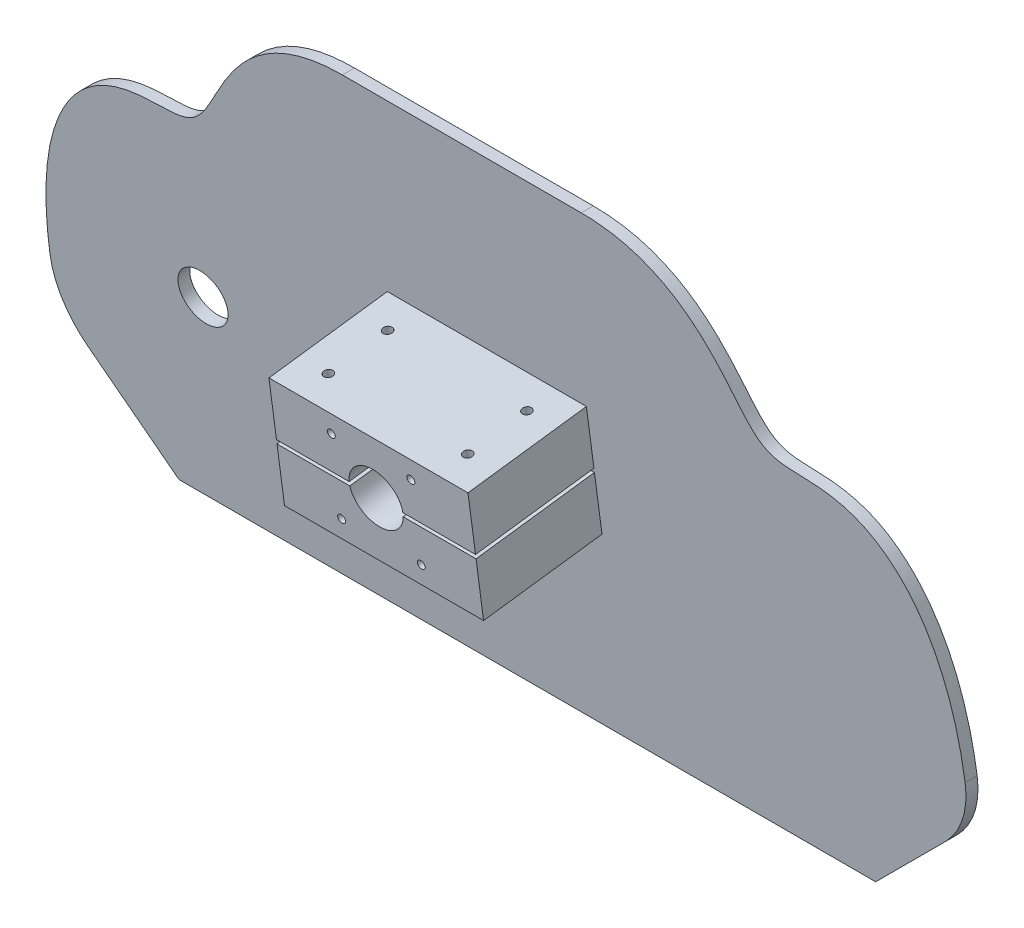
from build123d import *

# Parameters (mm, degrees)
EXTRUDE_START                      = -25
EXTRUDE_PLATE_SHAPE_DEPTH          = 50
CUT_EXTRUDE_ANGLE_DEPTH            = 341.53226913
CUT_EXTRUDE_ANGLE_DEPTH_BACK       = 341.53226913
EXTRUDE_SUPPORT_BLOCK_DEPTH        = 50
CUT_EXTRUDE_SHAFT_HOLE_DEPTH       = 349.426376391
CUT_EXTRUDE_SHAFT_HOLE_DEPTH_BACK  = 349.426376391
STEERING_WHEEL_SHAFT_HOLE_R        = 12.75
CUT_EXTRUDE_SWITCH_HOLE_DEPTH      = 349.426376391
CUT_EXTRUDE_SWITCH_HOLE_DEPTH_BACK = 349.426376391
IGNITION_SWITCH_HOLE_R             = 12.5
STEERING_WHEEL_RELIEF_HOLE_R       = 13.5
CUT_EXTRUDE_RELIEF_HOLE_DEPTH      = 60
CUT_EXTRUDE_SLOT_REACH             = 383.093
CUT_EXTRUDE_BOLT_HOLES_REACH       = 281.842
PRESSURE_BOLT_HOLES_R              = 2.25
ENCODER_PCB_MOUNT_HOLE_PATTERN_R   = 2
CUT_EXTRUDE_PCB_MOUNT_HOLES_DEPTH  = 60


# Read off the part's stored shape, not the designer's step: Extrude Plate Shape
with BuildPart() as part:
    # Extrude Plate Shape outline → Extrude Plate Shape (new body)
    with BuildSketch(Plane.XY.offset(EXTRUDE_START)):
        with BuildLine():
            Line((175, 0), (215.218833807, 40.218833807))
            ThreePointArc((215.218833807, 40.218833807), (226.057471223, 56.440000887), (229.863494748, 75.574172084))
            add(Edge.make_bspline(
                [(229.863494748, 75.574172084), (229.863497015, 220.574172084), (130.657195822, 208), (130.657198498, 108), (160, 250), (60, 250)],
                knots=[0, 0, 0, 0, 0, 0, 1, 1, 1, 1, 1, 1], degree=5))
            Line((60, 250), (-60, 250))
            add(Edge.make_bspline(
                [(-60, 250), (-160, 250), (-130.657198498, 108), (-130.657195822, 208), (-229.863497015, 220.574172084), (-229.863494748, 75.574172084)],
                knots=[0, 0, 0, 0, 0, 0, 1, 1, 1, 1, 1, 1], degree=5))
            ThreePointArc((-229.863494748, 75.574172084), (-226.057471223, 56.440000887), (-215.218833807, 40.218833807))
            Line((-215.218833807, 40.218833807), (-175, 0))
            Line((-175, 0), (175, 0))
        make_face()
    extrude(amount=EXTRUDE_PLATE_SHAPE_DEPTH)

    # 5-Degree Front Plate → Cut-Extrude Angle (cut, two sides: drawn at the far end of the back side and taken through both)
    with BuildSketch(Plane(origin=(0, 0, 0), x_dir=(0, 0, -1), z_dir=(1, 0, 0)).offset(-CUT_EXTRUDE_ANGLE_DEPTH_BACK)):
        Polygon((20.798974056, -10), (-14.747200293, 260), (35, 260), (35, -10), align=None)
        Polygon((-20.798974056, 260), (14.747200293, -10), (-35, -10), (-35, 260), align=None)
    extrude(amount=CUT_EXTRUDE_ANGLE_DEPTH + CUT_EXTRUDE_ANGLE_DEPTH_BACK, mode=Mode.SUBTRACT)

    # Support Block → Extrude Support Block (add, symmetric)
    with BuildSketch(Plane(origin=(0, 0, 0), x_dir=(0, 0, -1), z_dir=(1, 0, 0))):
        Polygon((-6.907883487, 154.486691682), (0.923688046, 95), (-58.563003637, 87.168428467), (-66.39457517, 146.655120149), align=None)
    extrude(amount=EXTRUDE_SUPPORT_BLOCK_DEPTH, both=True)

    # Steering Wheel Shaft Hole → Cut-Extrude Shaft Hole (cut, two sides: drawn at the far end of the back side and taken through both)
    with BuildSketch(Plane(origin=(0, 2.521214434, -19.150524903), x_dir=(-1, 0, 0), z_dir=(0, 0.13052619222005532, -0.99144486137381)).offset(-CUT_EXTRUDE_SHAFT_HOLE_DEPTH_BACK)):
        with Locations(Location((0, 124.614270251, 0), (0, 0, 90))):
            Circle(STEERING_WHEEL_SHAFT_HOLE_R)
    extrude(amount=CUT_EXTRUDE_SHAFT_HOLE_DEPTH + CUT_EXTRUDE_SHAFT_HOLE_DEPTH_BACK, mode=Mode.SUBTRACT)

    # Ignition Switch Hole → Cut-Extrude Switch Hole (cut, two sides: drawn at the far end of the back side and taken through both)
    with BuildSketch(Plane(origin=(0, 2.521214434, -19.150524903), x_dir=(-1, 0, 0), z_dir=(0, 0.13052619222005532, -0.99144486137381)).offset(-CUT_EXTRUDE_SWITCH_HOLE_DEPTH_BACK)):
        with Locations(Location((150, 97.457030106, 0), (0, 0, 90))):
            Circle(IGNITION_SWITCH_HOLE_R)
    extrude(amount=CUT_EXTRUDE_SWITCH_HOLE_DEPTH + CUT_EXTRUDE_SWITCH_HOLE_DEPTH_BACK, mode=Mode.SUBTRACT)

    # Steering Wheel Relief Hole → Cut-Extrude Relief Hole (cut)
    with BuildSketch(Plane(origin=(0, -6.093514253, 46.284835948), x_dir=(1, 0, 0), z_dir=(0, -0.13052619222005324, 0.9914448613738103))):
        with Locations(Location((0, 124.614270251, 0), (0, 0, 270))):
            Circle(STEERING_WHEEL_RELIEF_HOLE_R)
    extrude(amount=-CUT_EXTRUDE_RELIEF_HOLE_DEPTH, mode=Mode.SUBTRACT)

    # Cut-Extrude Slot: up to this face of the body (flat: up to its plane)
    cut_extrude_slot_end = Plane(part.part.faces().sort_by_distance((50, 120.827560075, 32.735443562))[0])
    # Tightening Slot → Cut-Extrude Slot (cut, up to the picked face)
    with BuildSketch(Plane.ZY.offset(50), mode=Mode.PRIVATE) as cut_extrude_slot_sk1:
        Polygon((62.609315595, 117.903219169), (62.348263211, 115.920329447), (2.861571529, 123.75190098), (3.122623913, 125.734790703), align=None)
    cut_extrude_slot_tool1 = split(extrude(cut_extrude_slot_sk1.sketch, amount=-CUT_EXTRUDE_SLOT_REACH, mode=Mode.PRIVATE), bisect_by=cut_extrude_slot_end, keep=Keep.BOTH, mode=Mode.PRIVATE)
    add(cut_extrude_slot_tool1.solids().sort_by(Axis((-50, 120.82756, 32.735444), (1, 0, 0)))[0], mode=Mode.SUBTRACT)

    # Cut-Extrude Bolt Holes: up to this face of the body (flat: up to its plane)
    cut_extrude_bolt_holes_end = Plane(part.part.faces().sort_by_distance((0, 91.084214233, 28.819657795))[0])
    # Pressure Bolt Holes → Cut-Extrude Bolt Holes (cut, up to the picked face)
    with BuildSketch(Plane(origin=(0, 152.748634402, 20.109739222), x_dir=(1, 0, 0), z_dir=(0, 0.99144486137381, 0.13052619222005454)), mode=Mode.PRIVATE) as cut_extrude_bolt_holes_sk1:
        with Locations(Location((-35, -1.684225972, 0), (0, 0, 270))):
            Circle(PRESSURE_BOLT_HOLES_R)
    cut_extrude_bolt_holes_tool1 = split(extrude(cut_extrude_bolt_holes_sk1.sketch, amount=-CUT_EXTRUDE_BOLT_HOLES_REACH, mode=Mode.PRIVATE), bisect_by=cut_extrude_bolt_holes_end, keep=Keep.BOTH, mode=Mode.PRIVATE)
    # Pressure Bolt Holes → Cut-Extrude Bolt Holes (cut, up to the picked face)
    with BuildSketch(Plane(origin=(0, 152.748634402, 20.109739222), x_dir=(1, 0, 0), z_dir=(0, 0.99144486137381, 0.13052619222005454)), mode=Mode.PRIVATE) as cut_extrude_bolt_holes_sk2:
        with Locations(Location((-35, -31.684225972, 0), (0, 0, 270))):
            Circle(PRESSURE_BOLT_HOLES_R)
    cut_extrude_bolt_holes_tool2 = split(extrude(cut_extrude_bolt_holes_sk2.sketch, amount=-CUT_EXTRUDE_BOLT_HOLES_REACH, mode=Mode.PRIVATE), bisect_by=cut_extrude_bolt_holes_end, keep=Keep.BOTH, mode=Mode.PRIVATE)
    # Pressure Bolt Holes → Cut-Extrude Bolt Holes (cut, up to the picked face)
    with BuildSketch(Plane(origin=(0, 152.748634402, 20.109739222), x_dir=(1, 0, 0), z_dir=(0, 0.99144486137381, 0.13052619222005454)), mode=Mode.PRIVATE) as cut_extrude_bolt_holes_sk3:
        with Locations(Location((35, -31.684225972, 0), (0, 0, 270))):
            Circle(PRESSURE_BOLT_HOLES_R)
    cut_extrude_bolt_holes_tool3 = split(extrude(cut_extrude_bolt_holes_sk3.sketch, amount=-CUT_EXTRUDE_BOLT_HOLES_REACH, mode=Mode.PRIVATE), bisect_by=cut_extrude_bolt_holes_end, keep=Keep.BOTH, mode=Mode.PRIVATE)
    # Pressure Bolt Holes → Cut-Extrude Bolt Holes (cut, up to the picked face)
    with BuildSketch(Plane(origin=(0, 152.748634402, 20.109739222), x_dir=(1, 0, 0), z_dir=(0, 0.99144486137381, 0.13052619222005454)), mode=Mode.PRIVATE) as cut_extrude_bolt_holes_sk4:
        with Locations(Location((35, -1.684225972, 0), (0, 0, 270))):
            Circle(PRESSURE_BOLT_HOLES_R)
    cut_extrude_bolt_holes_tool4 = split(extrude(cut_extrude_bolt_holes_sk4.sketch, amount=-CUT_EXTRUDE_BOLT_HOLES_REACH, mode=Mode.PRIVATE), bisect_by=cut_extrude_bolt_holes_end, keep=Keep.BOTH, mode=Mode.PRIVATE)
    add(cut_extrude_bolt_holes_tool1.solids().sort_by(Axis((-35, 152.528799, 21.779556), (0, -0.99144486137381, -0.13052619222005454)))[0], mode=Mode.SUBTRACT)
    add(cut_extrude_bolt_holes_tool2.solids().sort_by(Axis((-35, 148.613013, 51.522902), (0, -0.99144486137381, -0.13052619222005454)))[0], mode=Mode.SUBTRACT)
    add(cut_extrude_bolt_holes_tool3.solids().sort_by(Axis((35, 148.613013, 51.522902), (0, -0.99144486137381, -0.13052619222005454)))[0], mode=Mode.SUBTRACT)
    add(cut_extrude_bolt_holes_tool4.solids().sort_by(Axis((35, 152.528799, 21.779556), (0, -0.99144486137381, -0.13052619222005454)))[0], mode=Mode.SUBTRACT)

    # Encoder PCB Mount Hole Pattern → Cut-Extrude PCB Mount Holes (cut)
    with BuildSketch(Plane(origin=(0, -6.093514253, 46.284835948), x_dir=(1, 0, 0), z_dir=(0, -0.13052619222005565, 0.9914448613738099))):
        with Locations(Location((-20, 144.066696347, 0), (0, 0, 270))):
            Circle(ENCODER_PCB_MOUNT_HOLE_PATTERN_R)
        with Locations(Location((-20, 104.066696347, 0), (0, 0, 270))):
            Circle(ENCODER_PCB_MOUNT_HOLE_PATTERN_R)
        with Locations(Location((20, 104.066696347, 0), (0, 0, 270))):
            Circle(ENCODER_PCB_MOUNT_HOLE_PATTERN_R)
        with Locations(Location((20, 144.066696347, 0), (0, 0, 270))):
            Circle(ENCODER_PCB_MOUNT_HOLE_PATTERN_R)
    extrude(amount=-CUT_EXTRUDE_PCB_MOUNT_HOLES_DEPTH, mode=Mode.SUBTRACT)


solid = part.part
